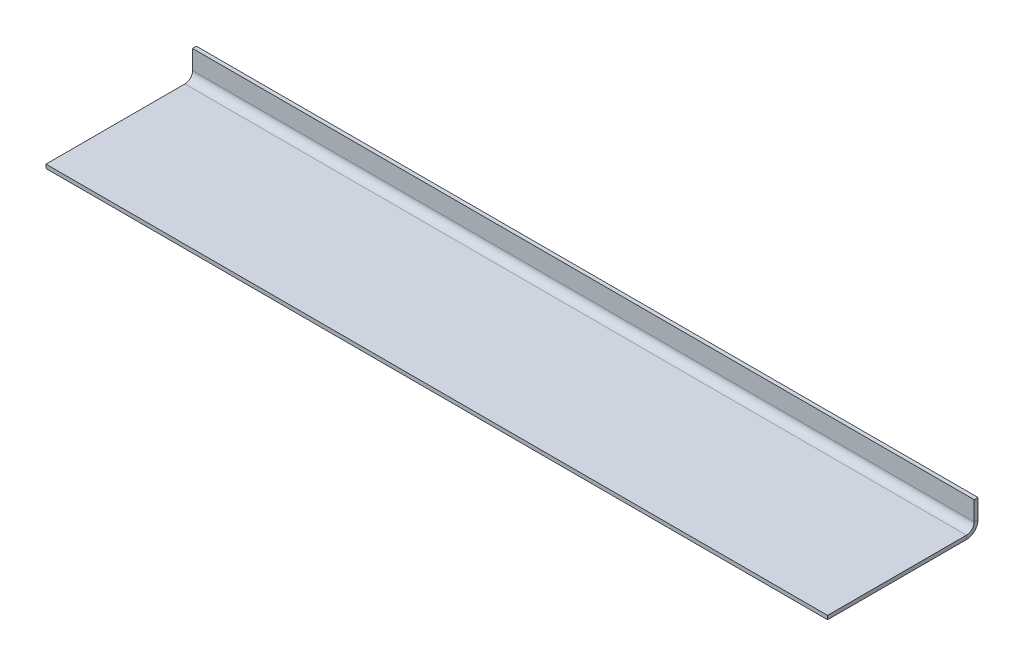
from build123d import *

# Parameters (mm, degrees)
SKETCH1_W                    = 645.65784
SKETCH1_H                    = 121.07672
BASE_FLANGE1_DEPTH           = 3.175
EDGE_FLANGE1_STRIP_W         = 25.4
EDGE_FLANGE1_STRIP_H         = 3.175
EDGE_FLANGE1_STRIP_CUT_DEPTH = 645.65784
EDGE_FLANGE1_DEPTH           = 645.65784


# Sheet-metal steps are written as plain solids
with BuildPart() as part:
    # Sketch1 → Base-Flange1 (new body)
    with BuildSketch(Plane(origin=(0, 0, 0), x_dir=(1, 0, 0), z_dir=(0, 1, 0))):
        with Locations((322.82892, 60.53836)):
            Rectangle(SKETCH1_W, SKETCH1_H)
    extrude(amount=-BASE_FLANGE1_DEPTH)

    # Edge-Flange1 strip (across the edge) → Edge-Flange1 strip cut (cut)
    with BuildSketch(Plane(origin=(645.65784, 0, -121.07672), x_dir=(0, 0, 1), z_dir=(-1, 0, 0))):
        with Locations((-6.35, -1.5875)):
            Rectangle(EDGE_FLANGE1_STRIP_W, EDGE_FLANGE1_STRIP_H)
    extrude(amount=EDGE_FLANGE1_STRIP_CUT_DEPTH, mode=Mode.SUBTRACT)

    # Edge-Flange1 section (across the edge) → Edge-Flange1 (add)
    with BuildSketch(Plane(origin=(645.65784, 0, -121.07672), x_dir=(0, 0, 1), z_dir=(-1, 0, 0))):
        with BuildLine():
            Line((-3.175, 6.35), (-3.175, 22.225))
            Line((-3.175, 22.225), (0, 22.225))
            Line((0, 22.225), (0, 6.35))
            ThreePointArc((0, 6.35), (1.859871939, 1.859871939), (6.35, 0))
            Line((6.35, 0), (6.35, -3.175))
            ThreePointArc((6.35, -3.175), (-0.385192091, -0.385192091), (-3.175, 6.35))
        make_face()
    extrude(amount=EDGE_FLANGE1_DEPTH)


solid = part.part
